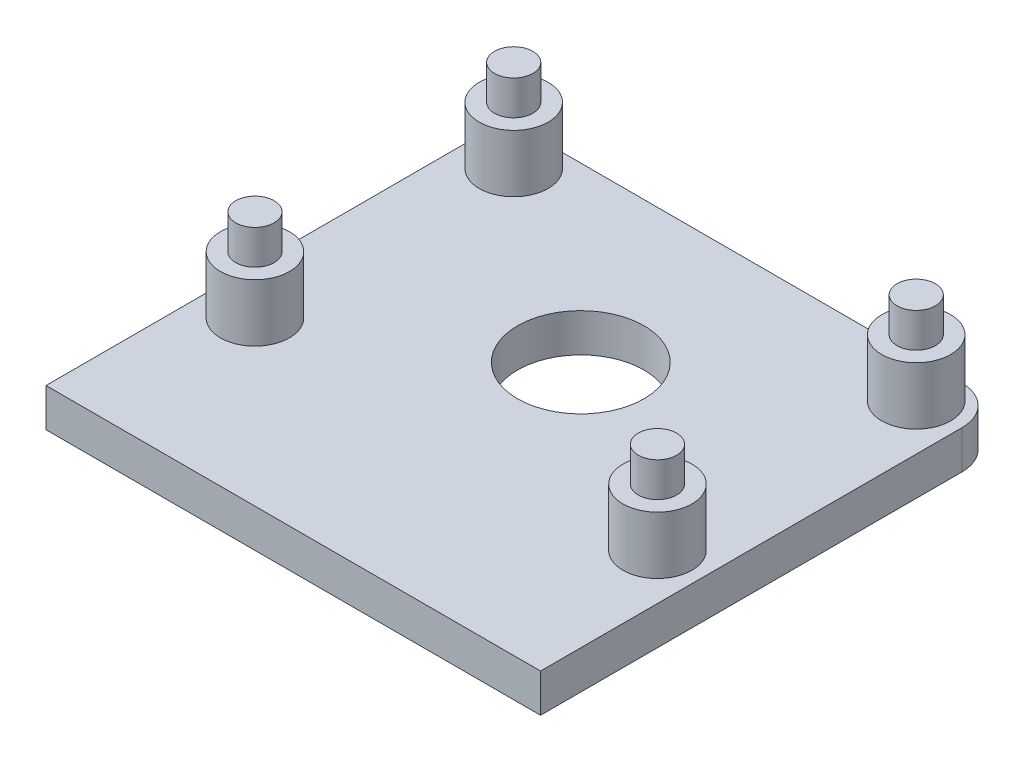
from build123d import *

# Parameters (mm, degrees)
SKETCH_1_W      = 25.8
SKETCH_1_H      = 24
SKETCH_1_R      = 3.3
EXTRUDE_1_DEPTH = 2
SKETCH_2_R      = 1
EXTRUDE_2_DEPTH = 4.8
FILLET_1_R      = 2
SKETCH_3_R      = 1.8
EXTRUDE_3_DEPTH = 3


with BuildPart() as part:
    # 草图1 → 凸台-拉伸1 (new body)
    with BuildSketch(Plane(origin=(0, 0, 0), x_dir=(1, 0, 0), z_dir=(0, 1, 0))):
        with Locations((-0.970485463, 3.121778757)):
            Rectangle(SKETCH_1_W, SKETCH_1_H)
        with Locations((-0.970485463, 6.121778757)):
            Circle(SKETCH_1_R, mode=Mode.SUBTRACT)
    extrude(amount=EXTRUDE_1_DEPTH)

    # 草图2 → 凸台-拉伸2 (add)
    with BuildSketch(Plane(origin=(0, 2, 0), x_dir=(1, 0, 0), z_dir=(0, 1, 0))):
        with Locations((-11.470485463, 13.121778757)):
            Circle(SKETCH_2_R)
        with Locations((9.529514537, 13.121778757)):
            Circle(SKETCH_2_R)
        with Locations((-11.470485463, -0.378221243)):
            Circle(SKETCH_2_R)
        with Locations((9.529514537, -0.378221243)):
            Circle(SKETCH_2_R)
    extrude(amount=EXTRUDE_2_DEPTH)

    # 圆角1
    fillet_1_edges = [part.edges().sort_by_distance(p)[0] for p in [
        (11.929514537, 1, -15.121778757),
        (-13.870485463, 1, -15.121778757),
    ]]
    fillet(fillet_1_edges, radius=FILLET_1_R)

    # 草图3 → 凸台-拉伸3 (add)
    with BuildSketch(Plane(origin=(0, 2, 0), x_dir=(1, 0, 0), z_dir=(0, 1, 0))):
        with Locations((-11.470485463, 13.121778757)):
            Circle(SKETCH_3_R)
        with Locations((9.529514537, 13.121778757)):
            Circle(SKETCH_3_R)
        with Locations((-11.470485463, -0.378221243)):
            Circle(SKETCH_3_R)
        with Locations((9.529514537, -0.378221243)):
            Circle(SKETCH_3_R)
    extrude(amount=EXTRUDE_3_DEPTH)


solid = part.part
